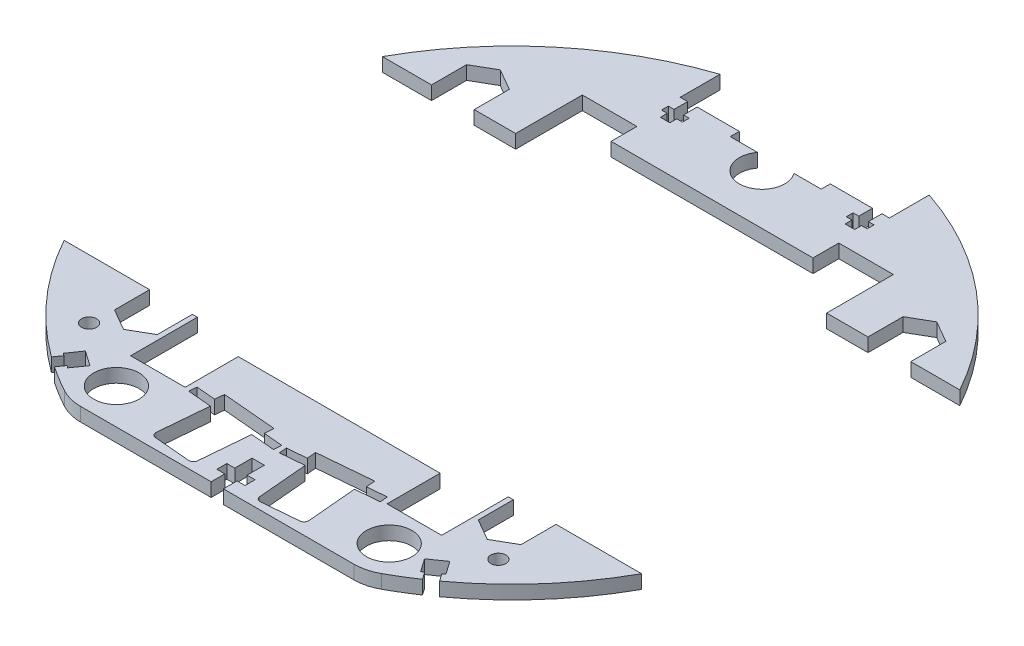
from build123d import *

# Parameters (mm, degrees)
BOSS_EXTRUDE1_DEPTH = 3
CUT_EXTRUDE1_DEPTH  = 103.574363269
SKETCH3_W           = 38.3
SKETCH3_H           = 70
CUT_EXTRUDE2_DEPTH  = 103.574363269
CUT_EXTRUDE3_DEPTH  = 97.418359248
CUT_EXTRUDE4_DEPTH  = 97.418359248
CUT_EXTRUDE5_DEPTH  = 97.418359248
SKETCH7_R           = 5
CUT_EXTRUDE6_DEPTH  = 94.63492938
CUT_EXTRUDE7_DEPTH  = 94.63492938
SKETCH9_W           = 4.6
SKETCH9_H           = 1.5
CUT_EXTRUDE8_DEPTH  = 94.63492938
SKETCH10_W          = 2.1
SKETCH10_H          = 3
SKETCH10_H_2        = 1.5
CUT_EXTRUDE9_DEPTH  = 94.63492938
SKETCH11_R          = 5
CUT_EXTRUDE10_DEPTH = 94.63492938
CUT_EXTRUDE11_DEPTH = 94.63492938
SKETCH13_R          = 1.65
CUT_EXTRUDE12_DEPTH = 94.63492938
CUT_EXTRUDE13_DEPTH = 94.63492938


with BuildPart() as part:
    # Sketch1 → Boss-Extrude1 (new body)
    with BuildSketch(Plane(origin=(0, 0, 0), x_dir=(1, 0, 0), z_dir=(0, 1, 0))):
        with BuildLine():
            Line((-30.029977361, -64.812867647), (30.029977361, -64.812867647))
            ThreePointArc((30.029977361, -64.812867647), (32.509837414, -64.500503794), (34.834773739, -63.582926471))
            ThreePointArc((34.834773739, -63.582926471), (0, 72.5), (-34.834773739, -63.582926471))
            ThreePointArc((-34.834773739, -63.582926471), (-32.509837414, -64.500503794), (-30.029977361, -64.812867647))
        make_face()
    extrude(amount=BOSS_EXTRUDE1_DEPTH)

    # Sketch2 → Cut-Extrude1 (cut, through all)
    with BuildSketch(Plane(origin=(0, 3, 0), x_dir=(1, 0, 0), z_dir=(0, 1, 0))):
        Polygon((-34.2, -49.675685802), (-22.2, -49.675685802), (-22.2, -38), (22.2, -38), (22.2, -49.675685802), (34.2, -49.675685802), (34.2, 49.675685802), (22.2, 49.675685802), (22.2, 44), (-22.2, 44), (-22.2, 49.675685802), (-34.2, 49.675685802), align=None)
    extrude(amount=-CUT_EXTRUDE1_DEPTH, mode=Mode.SUBTRACT)

    # Sketch3 → Cut-Extrude2 (cut, through all)
    with BuildSketch(Plane(origin=(0, 3, 0), x_dir=(1, 0, 0), z_dir=(0, 1, 0))):
        with Locations((-53.35, 0)):
            Rectangle(SKETCH3_W, SKETCH3_H)
        with Locations((53.35, 0)):
            Rectangle(SKETCH3_W, SKETCH3_H)
    extrude(amount=-CUT_EXTRUDE2_DEPTH, mode=Mode.SUBTRACT)


with BuildPart() as cut_extrude2_piece_1:
    # of the separate pieces the step leaves, piece 1, a body of its own (cut_extrude2_pieces)
    add(part.part.solids().sort_by_distance((63.492125496, 0, -35))[0])

    # Sketch6 → Cut-Extrude5 (cut, through all)
    with BuildSketch(Plane(origin=(0, 3, 0), x_dir=(1, 0, 0), z_dir=(0, 1, 0))):
        Polygon((-23, 72.5), (23, 72.5), (23, 60), (10, 60), (10, 58), (-10, 58), (-10, 60), (-23, 60), align=None)
    extrude(amount=-CUT_EXTRUDE5_DEPTH, mode=Mode.SUBTRACT)


with BuildPart() as cut_extrude2_piece_2:
    # of the separate pieces the step leaves, piece 2, a body of its own (cut_extrude2_pieces)
    add(part.part.solids().sort_by_distance((-34.834773739, 0, 63.582926471))[0])

    # Sketch4 → Cut-Extrude3 (cut, through all)
    with BuildSketch(Plane(origin=(0, 3, 0), x_dir=(1, 0, 0), z_dir=(0, 1, 0))):
        Polygon((-21.070156074, -50.026174921), (-0.648164763, -51.812867647), (-0.5, -50.11933666), (-20.921991311, -48.332643934), align=None)
        Polygon((21.070156074, -50.026174921), (20.921991311, -48.332643934), (0.5, -50.11933666), (0.648164763, -51.812867647), align=None)
    extrude(amount=-CUT_EXTRUDE3_DEPTH, mode=Mode.SUBTRACT)

    # Sketch5 → Cut-Extrude4 (cut, through all)
    with BuildSketch(Plane(origin=(0, 3, 0), x_dir=(1, 0, 0), z_dir=(0, 1, 0))):
        with BuildLine():
            Line((5.878186928, -51.355299998), (15.840133909, -50.48374257))
            Line((15.840133909, -50.48374257), (16.798847079, -61.441884249))
            ThreePointArc((16.798847079, -61.441884249), (16.568696824, -62.171827602), (15.889808123, -62.52523469))
            Line((15.889808123, -62.52523469), (7.920250539, -63.222480632))
            ThreePointArc((7.920250539, -63.222480632), (7.190307186, -62.992330377), (6.836900098, -62.313441677))
            Line((6.836900098, -62.313441677), (5.878186928, -51.355299998))
        make_face()
        Polygon((16.688163844, -48.703055841), (4.733827467, -49.748924754), (4.559515981, -47.756535357), (16.513852358, -46.710666444), align=None)
        Polygon((-16.513852358, -46.710666444), (-4.559515981, -47.756535357), (-4.733827467, -49.748924754), (-16.688163844, -48.703055841), align=None)
        with BuildLine():
            Line((-7.920250539, -63.222480632), (-15.889808123, -62.52523469))
            ThreePointArc((-15.889808123, -62.52523469), (-16.568696824, -62.171827602), (-16.798847079, -61.441884249))
            Line((-16.798847079, -61.441884249), (-15.840133909, -50.48374257))
            Line((-15.840133909, -50.48374257), (-5.878186928, -51.355299998))
            Line((-5.878186928, -51.355299998), (-6.836900098, -62.313441677))
            ThreePointArc((-6.836900098, -62.313441677), (-7.190307186, -62.992330377), (-7.920250539, -63.222480632))
        make_face()
    extrude(amount=-CUT_EXTRUDE4_DEPTH, mode=Mode.SUBTRACT)

    # Sketch7 → Cut-Extrude6 (cut, through all)
    with BuildSketch(Plane(origin=(0, 3, 0), x_dir=(1, 0, 0), z_dir=(0, 1, 0))):
        with Locations((-30, -57)):
            Circle(SKETCH7_R)
        with Locations((30, -57)):
            Circle(SKETCH7_R)
    extrude(amount=-CUT_EXTRUDE6_DEPTH, mode=Mode.SUBTRACT)


with BuildPart() as cut_extrude7_tool:
    # Sketch8 → Cut-Extrude7 (new, through all)
    with BuildSketch(Plane(origin=(0, 3, 0), x_dir=(1, 0, 0), z_dir=(0, 1, 0))):
        Polygon((-52.7, 37.286453735), (-52.7, 32.5), (-43.3, 32.5), (-43.3, 37.286453735), (-43.3, 42.713546265), (-48, 45.42709253), (-52.7, 42.713546265), align=None)
        Polygon((44.7, -32.5), (35.3, -32.5), (35.3, -37.286453735), (35.3, -42.713546265), (40, -45.42709253), (44.7, -42.713546265), (44.7, -37.286453735), align=None)
        Polygon((-35.3, -37.286453735), (-35.3, -32.5), (-44.7, -32.5), (-44.7, -37.286453735), (-44.7, -42.713546265), (-40, -45.42709253), (-35.3, -42.713546265), align=None)
        Polygon((52.7, 32.5), (52.7, 37.286453735), (52.7, 42.713546265), (48, 45.42709253), (43.3, 42.713546265), (43.3, 37.286453735), (43.3, 32.5), align=None)
    extrude(amount=-CUT_EXTRUDE7_DEPTH)


with BuildPart() as cut_extrude2_piece_1_1:
    add(cut_extrude2_piece_1.part)

    # Cut-Extrude7: cut by cut_extrude7_tool
    add(cut_extrude7_tool.part, mode=Mode.SUBTRACT)

    # Sketch9 → Cut-Extrude8 (cut, through all)
    with BuildSketch(Plane(origin=(0, 3, 0), x_dir=(1, 0, 0), z_dir=(0, 1, 0))):
        with Locations((20.32, 56.25)):
            Rectangle(SKETCH9_W, SKETCH9_H)
        with Locations((-20.32, 56.25)):
            Rectangle(SKETCH9_W, SKETCH9_H)
    extrude(amount=-CUT_EXTRUDE8_DEPTH, mode=Mode.SUBTRACT)

    # Sketch10 → Cut-Extrude9 (cut, through all)
    with BuildSketch(Plane(origin=(0, 3, 0), x_dir=(1, 0, 0), z_dir=(0, 1, 0))):
        with Locations((20.32, 58.5)):
            Rectangle(SKETCH10_W, SKETCH10_H)
        with Locations((20.32, 54.75)):
            Rectangle(SKETCH10_W, SKETCH10_H_2)
        with Locations((-20.32, 54.75)):
            Rectangle(SKETCH10_W, SKETCH10_H_2)
        with Locations((-20.32, 58.5)):
            Rectangle(SKETCH10_W, SKETCH10_H)
    extrude(amount=-CUT_EXTRUDE9_DEPTH, mode=Mode.SUBTRACT)

    # Sketch11 → Cut-Extrude10 (cut, through all)
    with BuildSketch(Plane(origin=(0, 3, 0), x_dir=(1, 0, 0), z_dir=(0, 1, 0))):
        with Locations((0, 55)):
            Circle(SKETCH11_R)
    extrude(amount=-CUT_EXTRUDE10_DEPTH, mode=Mode.SUBTRACT)


with BuildPart() as cut_extrude2_piece_2_1:
    add(cut_extrude2_piece_2.part)

    # Cut-Extrude7: cut by cut_extrude7_tool
    add(cut_extrude7_tool.part, mode=Mode.SUBTRACT)

    # Sketch12 → Cut-Extrude11 (cut, through all)
    with BuildSketch(Plane(origin=(0, 3, 0), x_dir=(1, 0, 0), z_dir=(0, 1, 0))):
        Polygon((-1.35, -64.812867647), (1.35, -64.812867647), (1.35, -61.812867647), (3.1, -61.812867647), (3.1, -59.612867647), (1.35, -59.612867647), (1.35, -55.812867647), (-1.35, -55.812867647), (-1.35, -59.612867647), (-3.1, -59.612867647), (-3.1, -61.812867647), (-1.35, -61.812867647), align=None)
    extrude(amount=-CUT_EXTRUDE11_DEPTH, mode=Mode.SUBTRACT)

    # Sketch13 → Cut-Extrude12 (cut, through all)
    with BuildSketch(Plane(origin=(0, 3, 0), x_dir=(1, 0, 0), z_dir=(0, 1, 0))):
        with Locations((45, -48)):
            Circle(SKETCH13_R)
        with Locations((-45, -48)):
            Circle(SKETCH13_R)
    extrude(amount=-CUT_EXTRUDE12_DEPTH, mode=Mode.SUBTRACT)

    # Sketch14 → Cut-Extrude13 (cut, through all)
    with BuildSketch(Plane.XZ):
        Polygon((-41.542994023, 56.975890933), (-42.075442851, 56.60306625), (-40.067925324, 53.736034095), (-36.791317147, 56.03033984), (-38.798834674, 58.897371995), (-39.331283503, 58.524547311), (-40.478436376, 60.1628514), (-42.690146895, 58.614195022), align=None)
        Polygon((41.542994023, 56.975890933), (42.690146895, 58.614195022), (40.478436376, 60.1628514), (39.331283503, 58.524547311), (38.798834674, 58.897371995), (36.791317147, 56.03033984), (40.067925324, 53.736034095), (42.075442851, 56.60306625), align=None)
    extrude(amount=-CUT_EXTRUDE13_DEPTH, mode=Mode.SUBTRACT)


solid = Compound([cut_extrude2_piece_1_1.part, cut_extrude2_piece_2_1.part])
